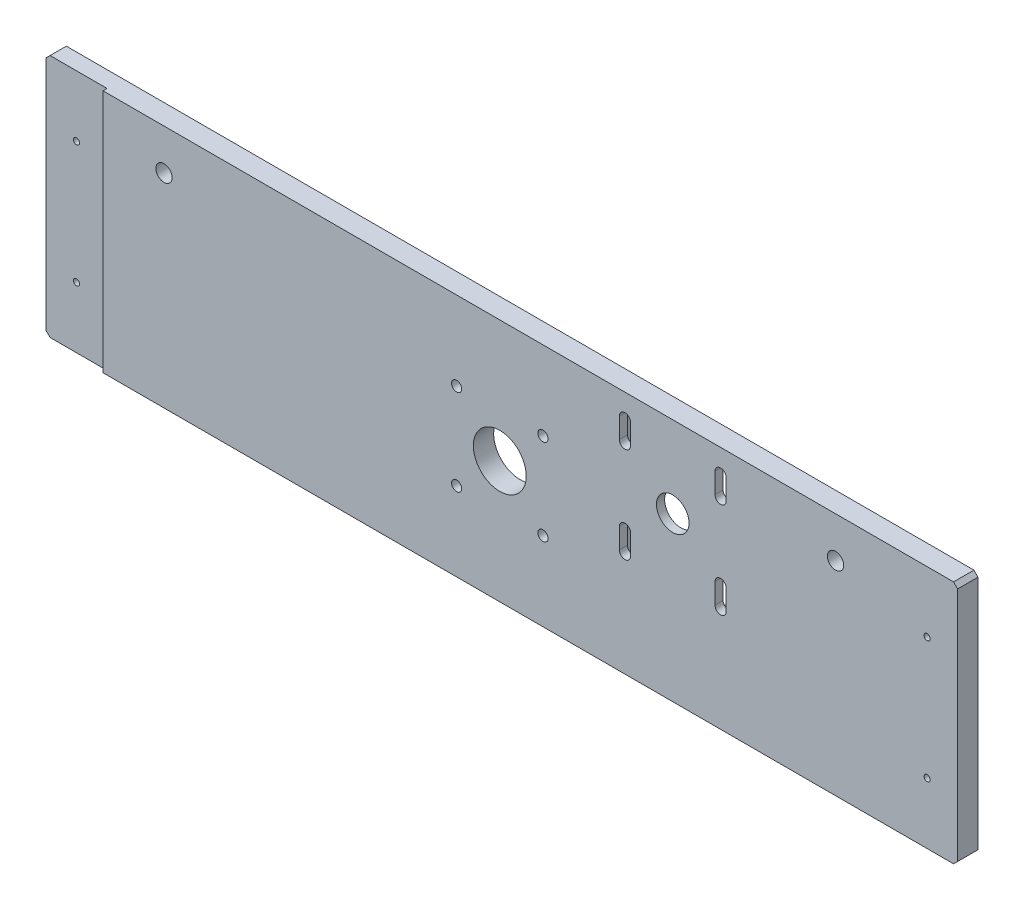
from build123d import *

# Parameters (mm, degrees)
SCHIZZO1_R                   = 13
SCHIZZO1_R_2                 = 2.5
SCHIZZO1_R_3                 = 4
SCHIZZO1_R_4                 = 1.5
SCHIZZO1_R_5                 = 8
ESTRUSIONE_ESTRUSIONE1_DEPTH = 10
SCHIZZO2_W                   = 30
SCHIZZO2_H                   = 120
TAGLIO_ESTRUSIONE1_DEPTH     = 2
SCHIZZO3_W                   = 60
SCHIZZO3_H                   = 72
TAGLIO_ESTRUSIONE2_DEPTH     = 6


with BuildPart() as part:
    # Schizzo1 → Estrusione-Estrusione1 (new body)
    with BuildSketch(Plane.XY):
        Polygon((2, 0), (448, 0), (450, 2), (450, 118), (448, 120), (2, 120), (0, 118), (0, 2), align=None)
        with Locations((225, 60)):
            Circle(SCHIZZO1_R, mode=Mode.SUBTRACT)
        with Locations((246.213203436, 81.213203436)):
            Circle(SCHIZZO1_R_2, mode=Mode.SUBTRACT)
        with Locations((390, 100)):
            Circle(SCHIZZO1_R_3, mode=Mode.SUBTRACT)
        with Locations((246.213203436, 38.786796564)):
            Circle(SCHIZZO1_R_2, mode=Mode.SUBTRACT)
        with Locations((203.786796564, 38.786796564)):
            Circle(SCHIZZO1_R_2, mode=Mode.SUBTRACT)
        with Locations((60, 100)):
            Circle(SCHIZZO1_R_3, mode=Mode.SUBTRACT)
        with Locations((15, 30)):
            Circle(SCHIZZO1_R_4, mode=Mode.SUBTRACT)
        with Locations((435, 30)):
            Circle(SCHIZZO1_R_4, mode=Mode.SUBTRACT)
        with Locations((203.786796564, 81.213203436)):
            Circle(SCHIZZO1_R_2, mode=Mode.SUBTRACT)
        with Locations((435, 90)):
            Circle(SCHIZZO1_R_4, mode=Mode.SUBTRACT)
        with Locations((15, 90)):
            Circle(SCHIZZO1_R_4, mode=Mode.SUBTRACT)
        with Locations((310, 80)):
            Circle(SCHIZZO1_R_5, mode=Mode.SUBTRACT)
        with BuildLine():
            Line((330.75, 108.5), (330.75, 98.5))
            ThreePointArc((330.75, 98.5), (333.5, 95.75), (336.25, 98.5))
            Line((336.25, 98.5), (336.25, 108.5))
            ThreePointArc((336.25, 108.5), (333.5, 111.25), (330.75, 108.5))
        make_face(mode=Mode.SUBTRACT)
        with BuildLine():
            Line((289.25, 108.5), (289.25, 98.5))
            ThreePointArc((289.25, 98.5), (286.5, 95.75), (283.75, 98.5))
            Line((283.75, 98.5), (283.75, 108.5))
            ThreePointArc((283.75, 108.5), (286.5, 111.25), (289.25, 108.5))
        make_face(mode=Mode.SUBTRACT)
        with BuildLine():
            Line((330.75, 51.5), (330.75, 61.5))
            ThreePointArc((330.75, 61.5), (333.5, 64.25), (336.25, 61.5))
            Line((336.25, 61.5), (336.25, 51.5))
            ThreePointArc((336.25, 51.5), (333.5, 48.75), (330.75, 51.5))
        make_face(mode=Mode.SUBTRACT)
        with BuildLine():
            Line((289.25, 51.5), (289.25, 61.5))
            ThreePointArc((289.25, 61.5), (286.5, 64.25), (283.75, 61.5))
            Line((283.75, 61.5), (283.75, 51.5))
            ThreePointArc((283.75, 51.5), (286.5, 48.75), (289.25, 51.5))
        make_face(mode=Mode.SUBTRACT)
    extrude(amount=-ESTRUSIONE_ESTRUSIONE1_DEPTH)

    # Schizzo2 → Taglio-Estrusione1 (cut)
    with BuildSketch(Plane.XY):
        with Locations((15, 60)):
            Rectangle(SCHIZZO2_W, SCHIZZO2_H)
        with Locations((615.438855383, 60)):
            Rectangle(SCHIZZO2_W, SCHIZZO2_H)
    extrude(amount=-TAGLIO_ESTRUSIONE1_DEPTH, mode=Mode.SUBTRACT)

    # Schizzo3 → Taglio-Estrusione2 (cut)
    with BuildSketch(Plane(origin=(0, 0, -10), x_dir=(-1, 0, 0), z_dir=(0, 0, -1))):
        with Locations((-310, 80)):
            Rectangle(SCHIZZO3_W, SCHIZZO3_H)
    extrude(amount=-TAGLIO_ESTRUSIONE2_DEPTH, mode=Mode.SUBTRACT)


solid = part.part
